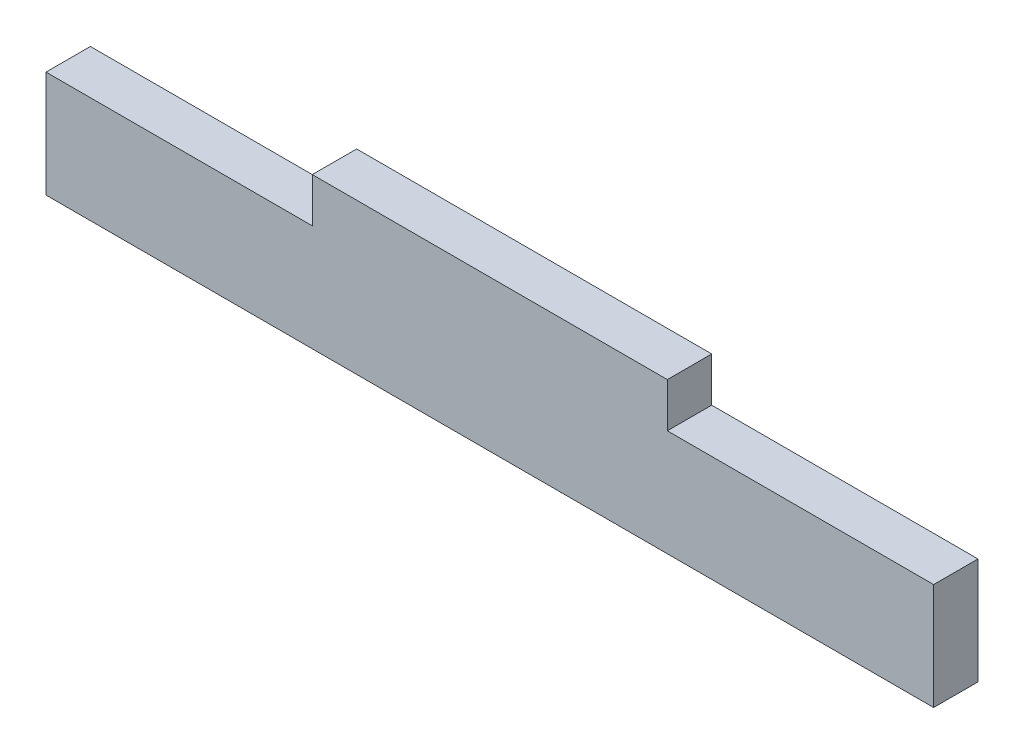
from build123d import *

# Parameters (mm, degrees)
AUFSATZ_LINEAR_AUSTRAGEN1_DEPTH = 5


with BuildPart() as part:
    # Skizze1 → Aufsatz-Linear austragen1 (new body)
    with BuildSketch(Plane.XY):
        Polygon((20, 17), (-20, 17), (-20, 12), (-50, 12), (-50, 0), (50, 0), (50, 12), (20, 12), align=None)
    extrude(amount=AUFSATZ_LINEAR_AUSTRAGEN1_DEPTH)


solid = part.part
